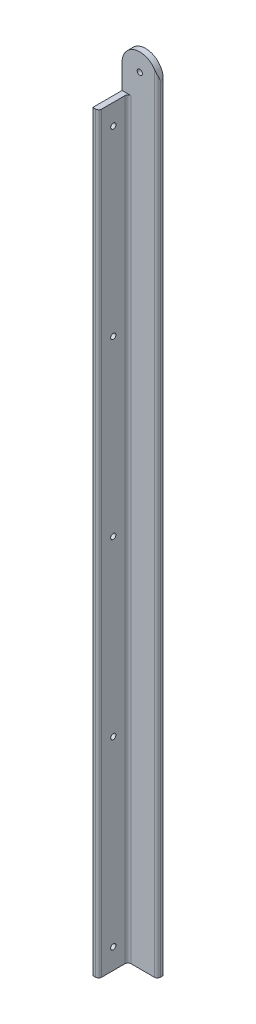
from build123d import *

# Parameters (mm, degrees)
BOSS_EXTRUDE1_DEPTH = 431.8
SKETCH4_W           = 15.875
SKETCH4_H           = 25.4
CUT_EXTRUDE1_DEPTH  = 6.35
SKETCH5_W           = 1.5875
SKETCH5_H           = 25.4
CUT_EXTRUDE2_DEPTH  = 6.35
SKETCH6_R           = 1.4224
CUT_EXTRUDE3_DEPTH  = 5.08
CUT_EXTRUDE4_START  = -2.54
CUT_EXTRUDE4_DEPTH  = 2.54
SKETCH8_R           = 1.4224
CUT_EXTRUDE5_DEPTH  = 5.08
SKETCH9_W           = 28.861002292
SKETCH9_H           = 547.524656259
CUT_EXTRUDE6_DEPTH  = 30.48
CUT_EXTRUDE7_DEPTH  = 5.08


with BuildPart() as part:
    # Sketch2 → Boss-Extrude1 (new body)
    with BuildSketch(Plane(origin=(0, 0, 0), x_dir=(1, 0, 0), z_dir=(0, 1, 0))):
        with BuildLine():
            Line((0, 0), (19.05, 0))
            Line((19.05, 0), (19.05, 1.5875))
            ThreePointArc((19.05, 1.5875), (18.585032015, 2.710032015), (17.4625, 3.175))
            Line((17.4625, 3.175), (4.7625, 3.175))
            ThreePointArc((4.7625, 3.175), (3.639967985, 3.639967985), (3.175, 4.7625))
            Line((3.175, 4.7625), (3.175, 17.4625))
            ThreePointArc((3.175, 17.4625), (2.710032015, 18.585032015), (1.5875, 19.05))
            Line((1.5875, 19.05), (0, 19.05))
            Line((0, 19.05), (0, 0))
        make_face()
    extrude(amount=BOSS_EXTRUDE1_DEPTH)

    # Sketch4 → Cut-Extrude1 (cut)
    with BuildSketch(Plane(origin=(3.175, 0, 0), x_dir=(0, 0, -1), z_dir=(1, 0, 0))):
        with Locations((11.1125, 419.1)):
            Rectangle(SKETCH4_W, SKETCH4_H)
    extrude(amount=-CUT_EXTRUDE1_DEPTH, mode=Mode.SUBTRACT)

    # Sketch5 → Cut-Extrude2 (cut)
    with BuildSketch(Plane.ZY.offset(-3.175)):
        with Locations((-3.96875, 419.1)):
            Rectangle(SKETCH5_W, SKETCH5_H)
    extrude(amount=-CUT_EXTRUDE2_DEPTH, mode=Mode.SUBTRACT)

    # Sketch6 → Cut-Extrude3 (cut)
    with BuildSketch(Plane(origin=(3.175, 0, 0), x_dir=(0, 0, -1), z_dir=(1, 0, 0))):
        with Locations((11.1125, 109.5375)):
            Circle(SKETCH6_R)
        with Locations((11.1125, 203.2)):
            Circle(SKETCH6_R)
        with Locations((11.1125, 296.8625)):
            Circle(SKETCH6_R)
        with Locations((11.1125, 11.1125)):
            Circle(SKETCH6_R)
        with Locations((11.1125, 395.2875)):
            Circle(SKETCH6_R)
    extrude(amount=-CUT_EXTRUDE3_DEPTH, mode=Mode.SUBTRACT)

    # Sketch7 → Cut-Extrude4 (cut)
    with BuildSketch(Plane(origin=(0, 431.8, 0), x_dir=(1, 0, 0), z_dir=(0, 1, 0)).offset(CUT_EXTRUDE4_START)):
        with BuildLine():
            Line((17.4625, 3.175), (0, 3.175))
            Line((0, 3.175), (0, 0))
            Line((0, 0), (19.05, 0))
            Line((19.05, 0), (19.05, 1.5875))
            ThreePointArc((19.05, 1.5875), (18.585032015, 2.710032015), (17.4625, 3.175))
        make_face()
    extrude(amount=CUT_EXTRUDE4_DEPTH, mode=Mode.SUBTRACT)

    # Sketch8 → Cut-Extrude5 (cut)
    with BuildSketch(Plane(origin=(0, 0, -3.175), x_dir=(-1, 0, 0), z_dir=(0, 0, -1))):
        with Locations((-9.525, 419.735)):
            Circle(SKETCH8_R)
    extrude(amount=-CUT_EXTRUDE5_DEPTH, mode=Mode.SUBTRACT)


with BuildPart() as body_2:
    # Mirror3: mirrored copy
    add(part.part.mirror(Plane.XY.offset(2.54)))

    # Sketch10 → Cut-Extrude7 (cut)
    with BuildSketch(Plane.XY.offset(8.255)):
        with BuildLine():
            Line((19.05, 419.735), (19.05, 429.26))
            Line((19.05, 429.26), (9.525, 429.26))
            ThreePointArc((9.525, 429.26), (16.260192091, 426.470192091), (19.05, 419.735))
        make_face()
        with BuildLine():
            ThreePointArc((0, 419.735), (2.789807909, 426.470192091), (9.525, 429.26))
            Line((9.525, 429.26), (0, 429.26))
            Line((0, 429.26), (0, 419.735))
        make_face()
    extrude(amount=-CUT_EXTRUDE7_DEPTH, mode=Mode.SUBTRACT)


with BuildPart() as part_1:
    add(part.part)

    # Sketch9 → Cut-Extrude6 (cut)
    with BuildSketch(Plane.XY.offset(2.54)):
        with Locations((7.805746781, 195.778589833)):
            Rectangle(SKETCH9_W, SKETCH9_H)
    extrude(amount=-CUT_EXTRUDE6_DEPTH, mode=Mode.SUBTRACT)


solid = body_2.part
